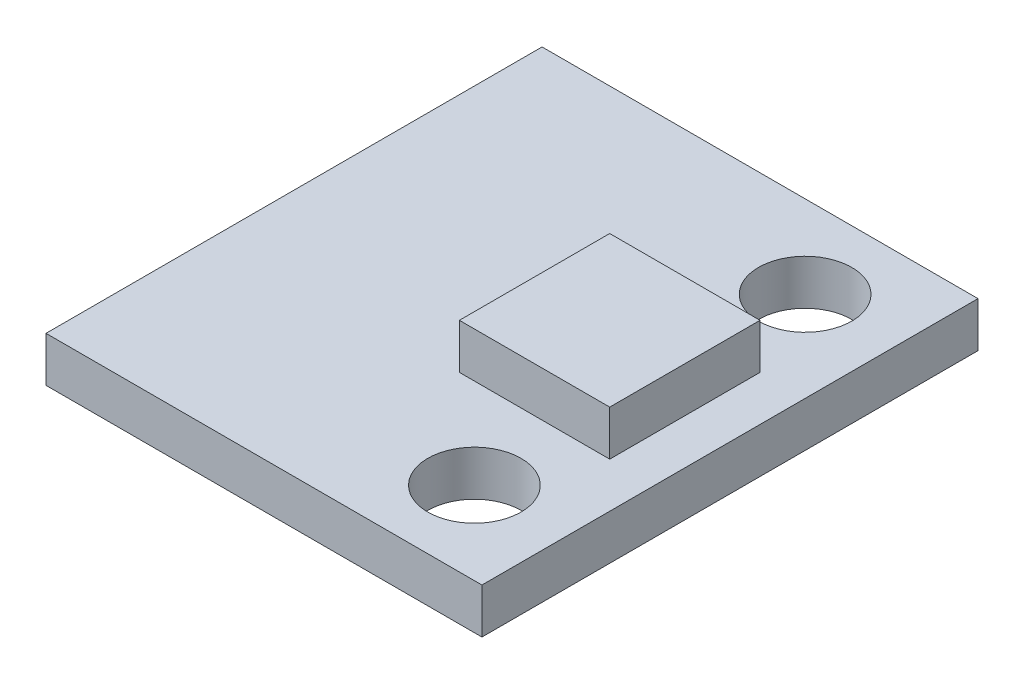
from build123d import *

# Parameters (mm, degrees)
SKETCH1_W           = 14.5
SKETCH1_H           = 16.5
BOSS_EXTRUDE1_DEPTH = 1.5
SKETCH2_R           = 1.55
CUT_EXTRUDE1_DEPTH  = 12.084899639
SKETCH3_W           = 5
SKETCH3_H           = 5
BOSS_EXTRUDE2_DEPTH = 1.5


with BuildPart() as part:
    # Sketch1 → Boss-Extrude1 (new body)
    with BuildSketch(Plane(origin=(0, 0, 0), x_dir=(1, 0, 0), z_dir=(0, 1, 0))):
        Rectangle(SKETCH1_W, SKETCH1_H)
    extrude(amount=BOSS_EXTRUDE1_DEPTH)

    # Sketch2 → Cut-Extrude1 (cut, through all)
    with BuildSketch(Plane(origin=(0, 1.5, 0), x_dir=(1, 0, 0), z_dir=(0, 1, 0))):
        with Locations((4.25, 5.5)):
            Circle(SKETCH2_R)
        with Locations((4.25, -5.5)):
            Circle(SKETCH2_R)
    extrude(amount=-CUT_EXTRUDE1_DEPTH, mode=Mode.SUBTRACT)

    # Sketch3 → Boss-Extrude2 (add)
    with BuildSketch(Plane(origin=(0, 1.5, 0), x_dir=(1, 0, 0), z_dir=(0, 1, 0))):
        with Locations((3.25, 0)):
            Rectangle(SKETCH3_W, SKETCH3_H)
    extrude(amount=BOSS_EXTRUDE2_DEPTH)


solid = part.part
